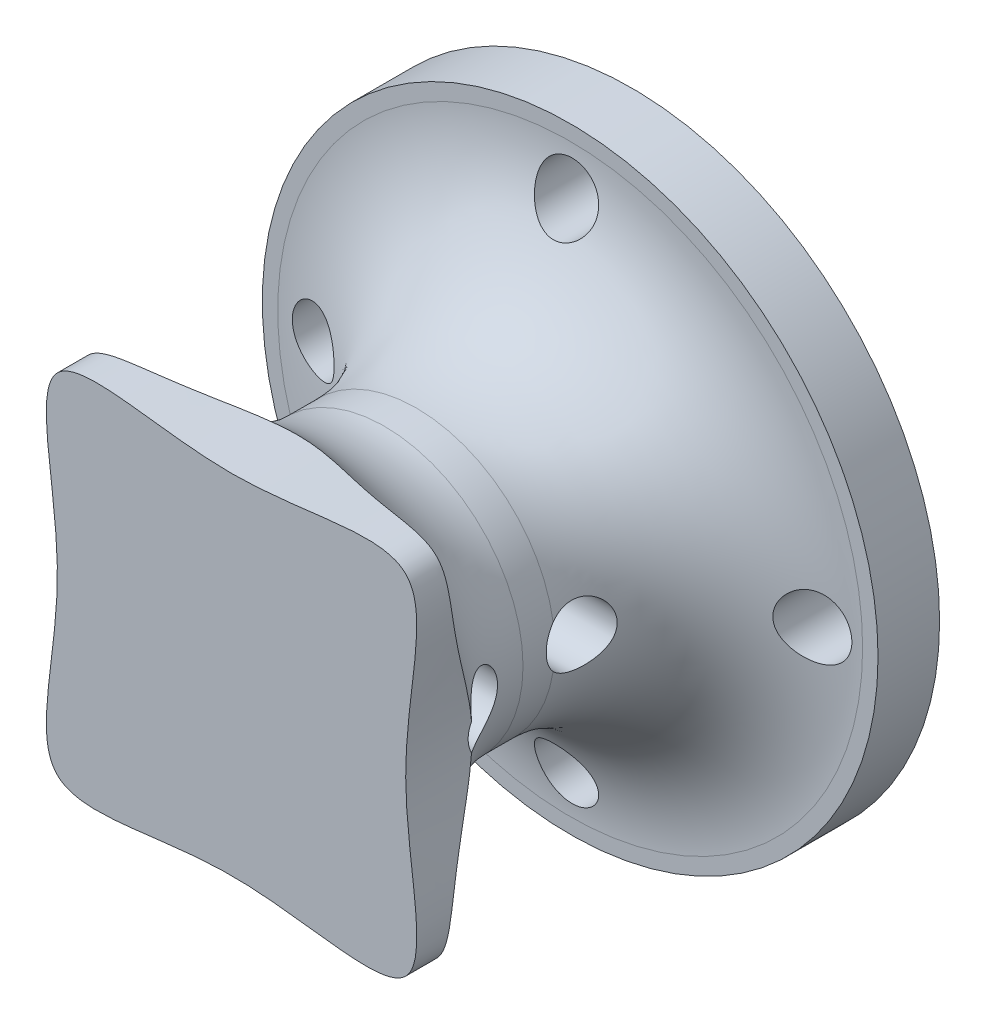
from build123d import *

# Parameters (mm, degrees)
SKIZZE1_R                            = 10
AUFSATZ_LINEAR_AUSTRAGEN1_DEPTH      = 2
SKIZZE4_R                            = 0.9999999999999998
SCHNITT_LINEAR_AUSTRAGEN1_DEPTH      = 2
KREISMUSTER1_COUNT                   = 4
SKIZZE5_R                            = 4.5
AUFSATZ_LINEAR_AUSTRAGEN2_DEPTH      = 10
SKIZZE6_R                            = 8
AUFSATZ_LINEAR_AUSTRAGEN3_DEPTH      = 1
SCHNITT_LINEAR_AUSTRAGEN2_DEPTH      = 5
SCHNITT_LINEAR_AUSTRAGEN2_DEPTH_BACK = 5
SKIZZE7_R                            = 1.0000000000000016
SKIZZE7_R_2                          = 0.9999999999999998
SKIZZE8_R                            = 4.25
SCHNITT_LINEAR_AUSTRAGEN3_DEPTH      = 2
VERRUNDUNG1_R                        = 4
VERRUNDUNG2_R                        = 5
SCHNITT_LINEAR_START                 = -5
SCHNITT_LINEAR_AUSTRAGEN5_DEPTH      = 5


with BuildPart() as part:
    # Skizze1 → Aufsatz-Linear austragen1 (new body)
    with BuildSketch(Plane.XY):
        Circle(SKIZZE1_R)
    extrude(amount=AUFSATZ_LINEAR_AUSTRAGEN1_DEPTH)

    # Skizze4 → Schnitt-Linear austragen1 (cut)
    with BuildSketch(Plane.XY.offset(2)):
        with Locations((-8, 0)):
            Circle(SKIZZE4_R)
    schnitt_linear_austragen1 = extrude(amount=-SCHNITT_LINEAR_AUSTRAGEN1_DEPTH, mode=Mode.SUBTRACT)

    # Kreismuster1: Schnitt-Linear austragen1 ×4 about axis
    kreismuster1_axis = Axis((0.08080808080807947, -1.411e-14, 0), (0, 0, 1))
    for i in range(1, KREISMUSTER1_COUNT):
        add(schnitt_linear_austragen1.rotate(kreismuster1_axis, i * 360 / KREISMUSTER1_COUNT), mode=Mode.SUBTRACT)

    # Skizze5 → Aufsatz-Linear austragen2 (add)
    with BuildSketch(Plane.XY.offset(2)):
        Circle(SKIZZE5_R)
    extrude(amount=AUFSATZ_LINEAR_AUSTRAGEN2_DEPTH)

    # Skizze6 → Aufsatz-Linear austragen3 (add)
    with BuildSketch(Plane.XY.offset(12)):
        Circle(SKIZZE6_R)
    extrude(amount=AUFSATZ_LINEAR_AUSTRAGEN3_DEPTH)

    # Skizze7 → Schnitt-Linear austragen2 (cut, two sides: drawn at the far end of the back side and taken through both)
    with BuildSketch(Plane(origin=(0, 0, 0), x_dir=(0, 0, -1), z_dir=(1, 0, 0)).offset(-SCHNITT_LINEAR_AUSTRAGEN2_DEPTH_BACK)):
        with Locations(Location((-9.972447250930827, 0, 0), (0, 0, 180))):
            Circle(SKIZZE7_R)
        with Locations(Location((-6.278379975599435, 0, 0), (0, 0, 180))):
            Circle(SKIZZE7_R_2)
    extrude(amount=SCHNITT_LINEAR_AUSTRAGEN2_DEPTH + SCHNITT_LINEAR_AUSTRAGEN2_DEPTH_BACK, mode=Mode.SUBTRACT)

    # Skizze8 → Schnitt-Linear austragen3 (cut)
    with BuildSketch(Plane.XY):
        Circle(SKIZZE8_R)
    extrude(amount=SCHNITT_LINEAR_AUSTRAGEN3_DEPTH, mode=Mode.SUBTRACT)

    # Verrundung1
    # the kernel refuses this fillet: 4 mm, written as the material it adds along each edge
    with BuildSketch(Plane(origin=(0, 0, 12), x_dir=(1, 0, 0), z_dir=(0, -1, 0))) as verrundung1_piece_1_section:
        with BuildLine():
            CenterArc((8.5, -3.9686269665968936), VERRUNDUNG1_R, 97.18075578145829, 82.81924421854171)
            Line((4.5, -3.9686269665968936), (4.42, -3.9686269665968936))
            Line((4.42, -3.9686269665968936), (4.42, 0))
            Line((4.42, 0), (4.5, 0.08000000000000007))
            ThreePointArc((4.5, 0.08000000000000007), (6.25, 0.08000000000000007), (7.99, 0.07937253933193134))
            Line((7.99, 0.07937253933193134), (8, -7.11e-15))
        make_face()
    verrundung1_piece_1 = revolve(axis=Axis((0, 0, 12), (0, 0, 1)), mode=Mode.PRIVATE)
    verrundung1_piece_1 = verrundung1_piece_1 - Plane(origin=(3.524769074488483, 0, 9.972447250930827), x_dir=(0, 1.2e-16, 1), z_dir=(-1, 0, 0)) * Cylinder(1.0000000000000016, 32, mode=Mode.PRIVATE)
    add(verrundung1_piece_1)

    # Verrundung2
    # the kernel refuses this fillet: 5 mm, written as the material it adds along each edge
    with BuildSketch(Plane(origin=(0, 0, 2), x_dir=(1, 0, 0), z_dir=(0, -1, 0))) as verrundung2_piece_1_section:
        with BuildLine():
            CenterArc((4.5 + VERRUNDUNG2_R, VERRUNDUNG2_R), VERRUNDUNG2_R, 180, 90)
            Line((4.5 + VERRUNDUNG2_R, -8.9e-16), (4.5, 0))
            Line((4.5, 0), (4.5, VERRUNDUNG2_R))
        make_face()
    verrundung2_piece_1 = revolve(axis=Axis((0, 0, 2), (0, 0, 1)), mode=Mode.PRIVATE)
    verrundung2_piece_1 = verrundung2_piece_1 - Plane(origin=(-5.921755204381712, 0, 6.278379975599435), x_dir=(0, 1.2e-16, 1), z_dir=(-1, 0, 0)) * Cylinder(0.9999999999999998, 38, mode=Mode.PRIVATE)
    verrundung2_piece_1 = verrundung2_piece_1 - Plane(origin=(0.08080808080806447, -8.080808080808094, 3.421755204381712), x_dir=(1.1e-16, 1, 0), z_dir=(0, 0, 1)) * Cylinder(0.9999999999999998, 38, mode=Mode.PRIVATE)
    verrundung2_piece_1 = verrundung2_piece_1 - Plane(origin=(8.161616161616159, -2.92e-14, 3.421755204381712), x_dir=(-1, 1.2e-16, 0), z_dir=(0, 0, 1)) * Cylinder(0.9999999999999998, 38, mode=Mode.PRIVATE)
    verrundung2_piece_1 = verrundung2_piece_1 - Plane(origin=(-8, 0, 3.421755204381712), x_dir=(1, 0, 0), z_dir=(0, 0, 1)) * Cylinder(0.9999999999999998, 38, mode=Mode.PRIVATE)
    verrundung2_piece_1 = verrundung2_piece_1 - Plane(origin=(0.08080808080809537, 8.080808080808065, 3.421755204381712), x_dir=(-2.2e-16, -1, 0), z_dir=(0, 0, 1)) * Cylinder(0.9999999999999998, 38, mode=Mode.PRIVATE)
    add(verrundung2_piece_1)

    # Skizze20 → Schnitt-Linear austragen5 (cut)
    with BuildSketch(Plane.XY.offset(13.000000000000002).offset(SCHNITT_LINEAR_START)):
        with BuildLine():
            add(Edge.make_bspline(
                [(-5.65685424949238, 6.7e-16), (-5.65685424949238, 2.424366106925307), (-6.464976285134149, 4.848732213850612), (-5.656854249492381, 5.656854249492381)],
                knots=[0.75, 0.75, 0.75, 0.75, 0.875, 0.875, 0.875, 0.875], degree=3))
            ThreePointArc((-5.65685424949238, 5.656854249492381), (-8, 9.8e-16), (-5.6568542494923815, -5.65685424949238))
            add(Edge.make_bspline(
                [(-5.6568542494923815, -5.656854249492381), (-6.464976285134149, -4.848732213850612), (-5.65685424949238, -2.4243661069253055), (-5.65685424949238, 6.7e-16)],
                knots=[0.625, 0.625, 0.625, 0.625, 0.75, 0.75, 0.75, 0.75], degree=3))
        make_face()
        with BuildLine():
            ThreePointArc((5.656854249492381, 5.65685424949238), (4.9e-16, 8), (-5.65685424949238, 5.656854249492381))
            add(Edge.make_bspline(
                [(-5.656854249492381, 5.6568542494923815), (-4.848732213850612, 6.464976285134149), (-2.4243661069253064, 5.65685424949238), (-2.2e-16, 5.65685424949238)],
                knots=[0.875, 0.875, 0.875, 0.875, 1, 1, 1, 1], degree=3))
            add(Edge.make_bspline(
                [(-2.2e-16, 5.65685424949238), (2.424366106925306, 5.65685424949238), (4.848732213850612, 6.464976285134149), (5.656854249492381, 5.656854249492381)],
                knots=[0, 0, 0, 0, 0.125, 0.125, 0.125, 0.125], degree=3))
        make_face()
        with BuildLine():
            ThreePointArc((8, 0), (7.391036260090294, 3.0614674589207183), (5.656854249492381, 5.65685424949238))
            add(Edge.make_bspline(
                [(5.656854249492381, 5.656854249492381), (6.464976285134149, 4.848732213850612), (5.65685424949238, 2.4243661069253055), (5.65685424949238, -6.7e-16)],
                knots=[0.125, 0.125, 0.125, 0.125, 0.25, 0.25, 0.25, 0.25], degree=3))
            add(Edge.make_bspline(
                [(5.65685424949238, -6.7e-16), (5.65685424949238, -2.424366106925307), (6.464976285134149, -4.848732213850612), (5.656854249492381, -5.656854249492381)],
                knots=[0.25, 0.25, 0.25, 0.25, 0.375, 0.375, 0.375, 0.375], degree=3))
            ThreePointArc((5.656854249492379, -5.6568542494923815), (7.391036260090292, -3.061467458920723), (8, -1.96e-15))
        make_face()
        with BuildLine():
            add(Edge.make_bspline(
                [(-6.7e-16, -5.65685424949238), (-2.424366106925307, -5.65685424949238), (-4.848732213850612, -6.464976285134149), (-5.656854249492381, -5.656854249492381)],
                knots=[0.5, 0.5, 0.5, 0.5, 0.625, 0.625, 0.625, 0.625], degree=3))
            ThreePointArc((-5.6568542494923815, -5.65685424949238), (-1.47e-15, -8), (5.656854249492379, -5.6568542494923815))
            add(Edge.make_bspline(
                [(5.656854249492381, -5.6568542494923815), (4.848732213850612, -6.464976285134149), (2.4243661069253055, -5.65685424949238), (-6.7e-16, -5.65685424949238)],
                knots=[0.375, 0.375, 0.375, 0.375, 0.5, 0.5, 0.5, 0.5], degree=3))
        make_face()
    extrude(amount=SCHNITT_LINEAR_AUSTRAGEN5_DEPTH, mode=Mode.SUBTRACT)


solid = part.part
